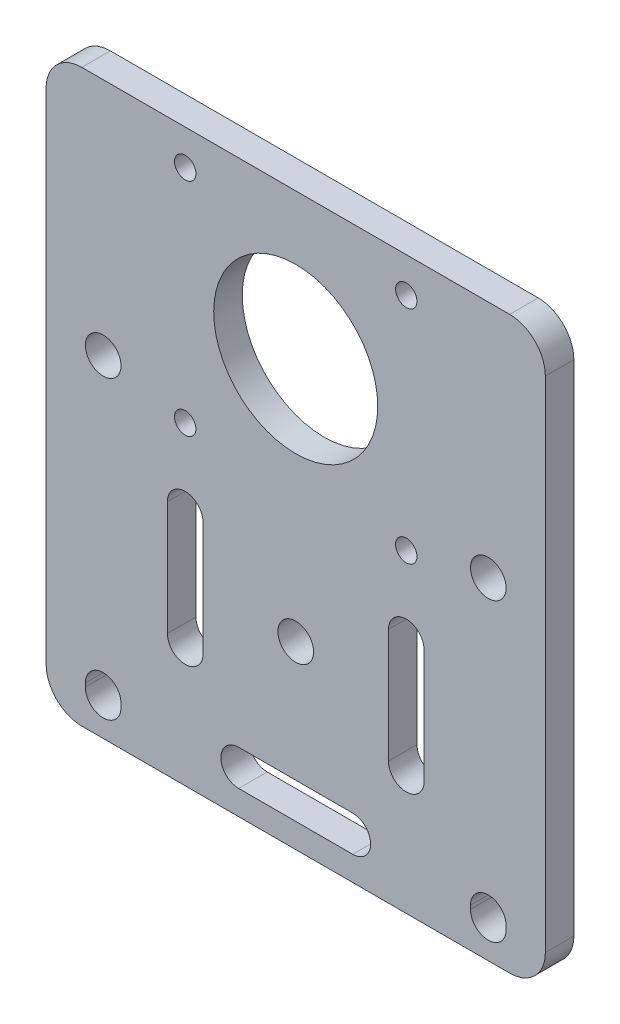
from build123d import *

# Parameters (mm, degrees)
SKETCH4_W           = 70
SKETCH4_H           = 80
SKETCH4_R           = 2.5
BOSS_EXTRUDE2_DEPTH = 4
SKETCH5_R           = 11.5
SKETCH5_R_2         = 1.5
SKETCH5_R_3         = 2.5
CUT_EXTRUDE2_DEPTH  = 54.301031885
FILLET1_R           = 5


with BuildPart() as part:
    # Sketch4 → Boss-Extrude2 (new body)
    with BuildSketch(Plane.XY):
        Rectangle(SKETCH4_W, SKETCH4_H)
        with Locations((-27, 6.5)):
            Circle(SKETCH4_R, mode=Mode.SUBTRACT)
        with Locations((27, 6.5)):
            Circle(SKETCH4_R, mode=Mode.SUBTRACT)
        with BuildLine():
            Line((-24.5, -34.5), (-24.5, -35))
            ThreePointArc((-24.5, -35), (-27, -37.5), (-29.5, -35))
            Line((-29.5, -35), (-29.5, -34.5))
            ThreePointArc((-29.5, -34.5), (-27, -32), (-24.5, -34.5))
        make_face(mode=Mode.SUBTRACT)
        with BuildLine():
            Line((24.5, -34.5), (24.5, -35))
            ThreePointArc((24.5, -35), (27, -37.5), (29.5, -35))
            Line((29.5, -35), (29.5, -34.5))
            ThreePointArc((29.5, -34.5), (27, -32), (24.5, -34.5))
        make_face(mode=Mode.SUBTRACT)
    extrude(amount=BOSS_EXTRUDE2_DEPTH)

    # Sketch5 → Cut-Extrude2 (cut, through all)
    with BuildSketch(Plane.XY.offset(4)):
        with Locations((0, 19.576696831)):
            Circle(SKETCH5_R)
        with Locations((-15.5, 35.076696831)):
            Circle(SKETCH5_R_2)
        with Locations((15.5, 35.076696831)):
            Circle(SKETCH5_R_2)
        with Locations((15.5, 4.076696831)):
            Circle(SKETCH5_R_2)
        with Locations((-15.5, 4.076696831)):
            Circle(SKETCH5_R_2)
        with Locations((0, -14.75)):
            Circle(SKETCH5_R_3)
        with BuildLine():
            Line((-8, -31.570071963), (8, -31.570071963))
            ThreePointArc((8, -31.570071963), (10.5, -34.070071963), (8, -36.570071963))
            Line((8, -36.570071963), (-8, -36.570071963))
            ThreePointArc((-8, -36.570071963), (-10.5, -34.070071963), (-8, -31.570071963))
        make_face()
        with BuildLine():
            Line((-13, -6.75), (-13, -22.75))
            ThreePointArc((-13, -22.75), (-15.5, -25.25), (-18, -22.75))
            Line((-18, -22.75), (-18, -6.75))
            ThreePointArc((-18, -6.75), (-15.5, -4.25), (-13, -6.75))
        make_face()
        with BuildLine():
            Line((13, -6.75), (13, -22.75))
            ThreePointArc((13, -22.75), (15.5, -25.25), (18, -22.75))
            Line((18, -22.75), (18, -6.75))
            ThreePointArc((18, -6.75), (15.5, -4.25), (13, -6.75))
        make_face()
    extrude(amount=-CUT_EXTRUDE2_DEPTH, mode=Mode.SUBTRACT)

    # Fillet1
    fillet1_edges = [part.edges().sort_by_distance(p)[0] for p in [
        (-35, -40, 2),
        (35, -40, 2),
        (35, 40, 2),
        (-35, 40, 2),
    ]]
    fillet(fillet1_edges, radius=FILLET1_R)


solid = part.part
